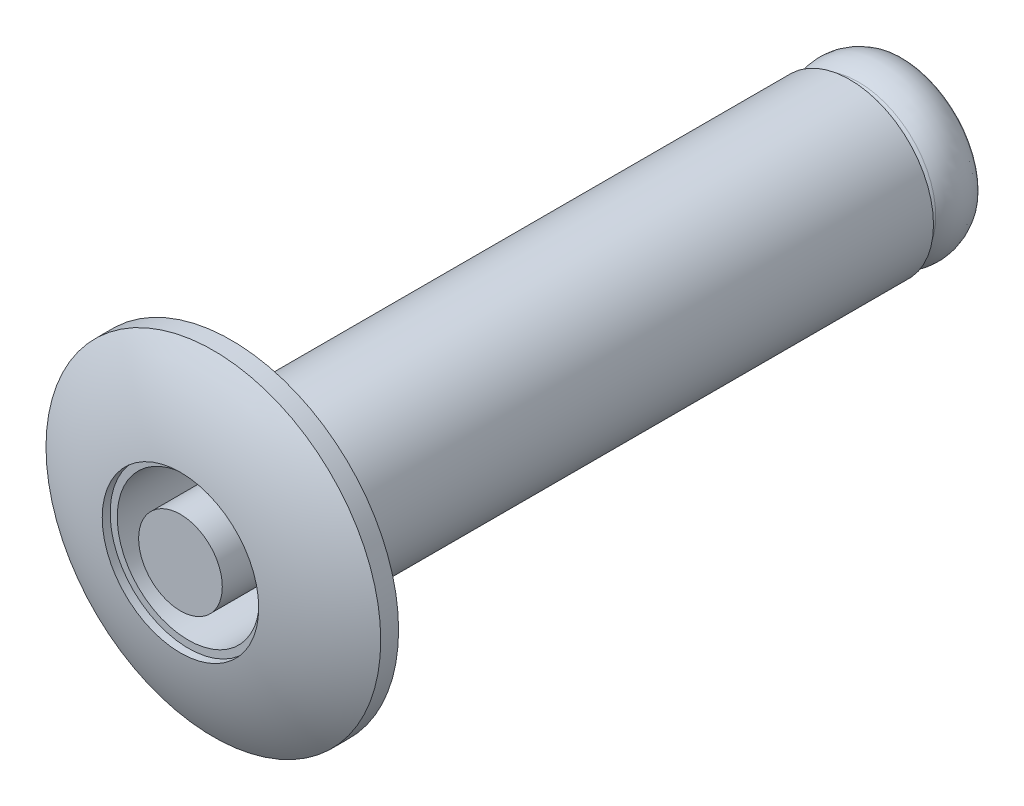
from build123d import *

# Parameters (mm, degrees)
FILLET3_R               = 0.127
SKETCH5_R               = 1.4843125
CUT_EXTRUDE2_DEPTH      = 0.2032
CUT_EXTRUDE1_DEPTH      = 25.893891994
CUT_EXTRUDE1_DEPTH_BACK = 25.893891994
FILLET2_R               = 0.254
CUT_EXTRUDE3_DEPTH      = 25.893891994
CUT_EXTRUDE3_DEPTH_BACK = 25.893891994
SKETCH6_W               = 23.522610405
SKETCH6_H               = 3.175


with BuildPart() as part:
    # Sketch2 → Revolve1 (revolve)
    with BuildSketch(Plane(origin=(0, 0, 0), x_dir=(0, 0, -1), z_dir=(1, 0, 0))):
        with BuildLine():
            Line((-24.4856, 0), (-24.4856, 0.79375))
            Line((-24.4856, 0.79375), (-1.016, 0.79375))
            Line((-1.016, 0.79375), (11.8364, 0.79375))
            Line((11.8364, 0.79375), (11.8364, 1.42875))
            ThreePointArc((11.8364, 1.42875), (12.2936, 1.5875), (12.7508, 1.42875))
            Line((12.7508, 1.42875), (12.7508, 0))
            Line((12.7508, 0), (-24.4856, 0))
        make_face()
    revolve(axis=Axis((0, 0, 24.4856), (0, 0, -1)))

    # Fillet3
    fillet3_edges = [part.edges().sort_by_distance(p)[0] for p in [
        (0, -1.42875, -11.8364),
        (0, -1.42875, -12.7508),
    ]]
    fillet(fillet3_edges, radius=FILLET3_R)

    # Sketch3 → Cut-Extrude1 (cut, two sides: drawn at the far end of the back side and taken through both)
    with BuildSketch(Plane(origin=(0, 0, 0), x_dir=(1, 0, 0), z_dir=(0, 1, 0)).offset(-CUT_EXTRUDE1_DEPTH_BACK)):
        Polygon((0, -24.4856), (0.99695, -23.186349465), (0.99695, -24.9936), (-0.99695, -24.9936), (-0.99695, -23.186349465), align=None)
    extrude(amount=CUT_EXTRUDE1_DEPTH + CUT_EXTRUDE1_DEPTH_BACK, mode=Mode.SUBTRACT)

    # Sketch6 → Cut-Extrude3 (cut, two sides: drawn at the far end of the back side and taken through both)
    with BuildSketch(Plane(origin=(0, 0, 0), x_dir=(0, 0, -1), z_dir=(1, 0, 0)).offset(-CUT_EXTRUDE3_DEPTH_BACK)):
        with Locations((-12.724294798, 0)):
            Rectangle(SKETCH6_W, SKETCH6_H)
    extrude(amount=CUT_EXTRUDE3_DEPTH + CUT_EXTRUDE3_DEPTH_BACK, mode=Mode.SUBTRACT)


with BuildPart() as body_2:
    # Sketch4 → Revolve2 (revolve)
    with BuildSketch(Plane(origin=(0, 0, 0), x_dir=(0, 0, -1), z_dir=(1, 0, 0))):
        with BuildLine():
            Line((-0.338666667, 3.175), (0, 3.175))
            Line((0, 3.175), (0, 1.5875))
            Line((0, 1.5875), (11.7348, 1.5875))
            Line((11.7348, 1.5875), (11.7348, 1.349375))
            Line((11.7348, 1.349375), (-0.981753691, 1.349375))
            ThreePointArc((-0.981753691, 1.349375), (-0.7589793, 2.296979497), (-0.338666667, 3.175))
        make_face()
    revolve(axis=Axis((0, 0, 0), (0, 0, -1)))

    # Sketch5 → Cut-Extrude2 (cut)
    with BuildSketch(Plane.XY.offset(1.016)):
        Circle(SKETCH5_R)
    extrude(amount=-CUT_EXTRUDE2_DEPTH, mode=Mode.SUBTRACT)

    # Fillet2
    fillet2_edges = [body_2.edges().sort_by_distance(p)[0] for p in [
        (0, -1.5875, 0),
    ]]
    fillet(fillet2_edges, radius=FILLET2_R)


solid = Compound([part.part, body_2.part])
